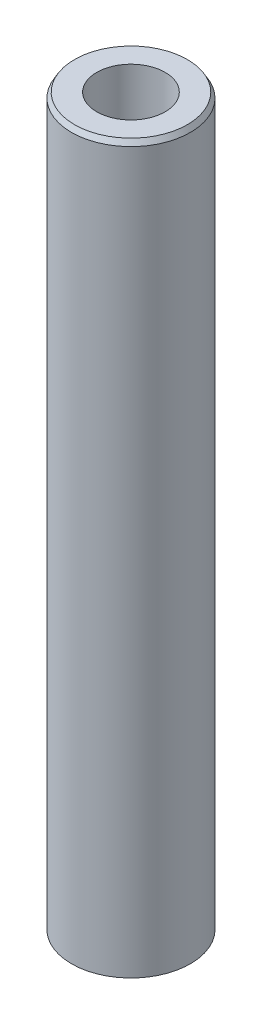
from build123d import *
from OCP.BRepFilletAPI import BRepFilletAPI_MakeChamfer

# Parameters (mm, degrees)
SKETCH1_R           = 15
BOSS_EXTRUDE1_DEPTH = 183.721375715
SKETCH2_R           = 8.628832075
CUT_EXTRUDE1_DEPTH  = 185.942001435
CHAMFER1_SIZE       = 1.315083882
CHAMFER1_SIZE2      = 0.759264033


with BuildPart() as part:
    # Sketch1 → Boss-Extrude1 (new body)
    with BuildSketch(Plane(origin=(0, 0, 0), x_dir=(1, 0, 0), z_dir=(0, 1, 0))):
        Circle(SKETCH1_R)
    extrude(amount=BOSS_EXTRUDE1_DEPTH)

    # Sketch2 → Cut-Extrude1 (cut, through all)
    with BuildSketch(Plane(origin=(0, 0, 0), x_dir=(1, 0, 0), z_dir=(0, 1, 0))):
        Circle(SKETCH2_R)
    extrude(amount=CUT_EXTRUDE1_DEPTH, mode=Mode.SUBTRACT)

    # Chamfer1: one chamfer whose edges measure the first distance from different faces: ONE call of the kernel's chamfer builder (chamfer() names one face for all edges)
    chamfer1_edges_1 = [part.edges().sort_by_distance(p)[0] for p in [
        (-15, 183.721375715, 0),
    ]]
    chamfer1_side_1 = [part.faces().sort_by_distance(p)[0] for p in [
        (-15, 91.860687858, 0),
    ]]
    chamfer1_edges_2 = [part.edges().sort_by_distance(p)[0] for p in [
        (-15, 0, 0),
    ]]
    chamfer1_side_2 = [part.faces().sort_by_distance(p)[0] for p in [
        (-14.575735931, 0, 0),
    ]]
    chamfer1 = BRepFilletAPI_MakeChamfer(part.part.solid().wrapped)
    for e in chamfer1_edges_1:
        chamfer1.Add(CHAMFER1_SIZE, CHAMFER1_SIZE2, e.wrapped, chamfer1_side_1[0].wrapped)  # the first distance lies on this face
    for e in chamfer1_edges_2:
        chamfer1.Add(CHAMFER1_SIZE, CHAMFER1_SIZE2, e.wrapped, chamfer1_side_2[0].wrapped)  # the first distance lies on this face
    add(Compound.cast(chamfer1.Shape()), mode=Mode.REPLACE)


solid = part.part
